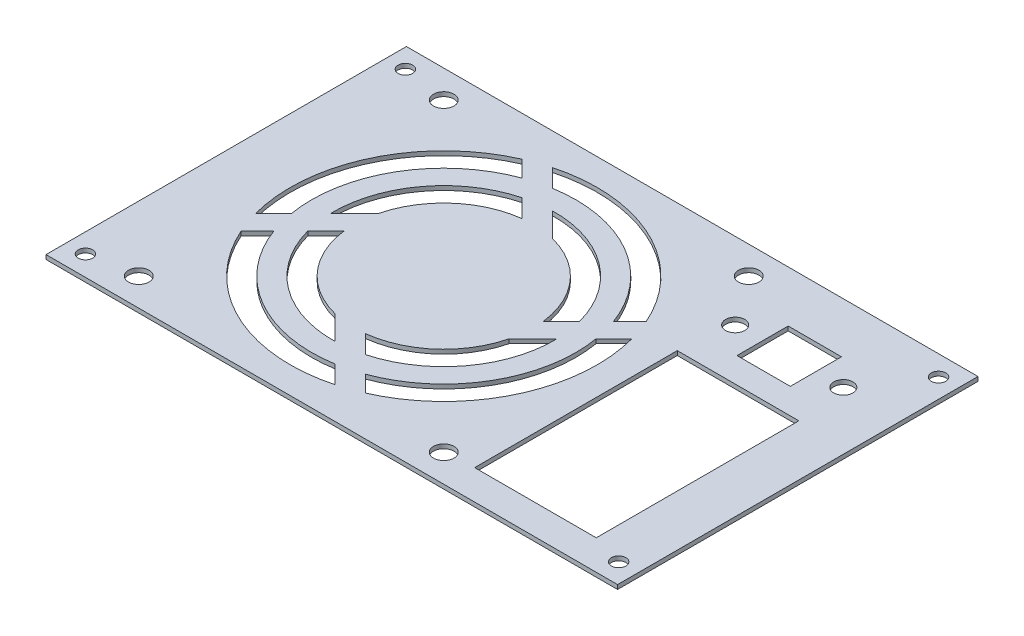
from build123d import *

# Parameters (mm, degrees)
SKETCH1_W                = 134
SKETCH1_H                = 84.5
BOSS_EXTRUDE1_DEPTH      = 1
M3_CLEARANCE_HOLE1_D     = 3.4
M3_CLEARANCE_HOLE1_DEPTH = 5
M3_CLEARANCE_HOLE1_TIP   = 1.021463052
M4_CLEARANCE_HOLE1_D     = 4.8
SKETCH9_W                = 28.5
SKETCH9_H                = 47.5
SKETCH9_W_2              = 12.5
SKETCH9_H_2              = 12
CUT_EXTRUDE1_DEPTH       = 159.421116017
M4_CLEARANCE_HOLE2_D     = 4.5
CUT_EXTRUDE5_DEPTH       = 159.421116017


with BuildPart() as part:
    # Sketch1 → Boss-Extrude1 (new body)
    with BuildSketch(Plane(origin=(0, 0, 0), x_dir=(1, 0, 0), z_dir=(0, 1, 0))):
        with Locations((67, 42.25)):
            Rectangle(SKETCH1_W, SKETCH1_H)
    extrude(amount=BOSS_EXTRUDE1_DEPTH)

    # M3 Clearance Hole1
    with Locations(Plane(origin=(0, 1, 0), x_dir=(1, 0, 0), z_dir=(0, 1, 0))):
        with Locations((4.5, 79.75), (129.5, 79.75), (129.5, 4.75), (4.5, 4.75)):
            Hole(M3_CLEARANCE_HOLE1_D / 2, depth=M3_CLEARANCE_HOLE1_DEPTH)
            with Locations((0, 0, -(M3_CLEARANCE_HOLE1_DEPTH + M3_CLEARANCE_HOLE1_TIP / 2))):  # 118° drill point
                Cone(0, M3_CLEARANCE_HOLE1_D / 2, M3_CLEARANCE_HOLE1_TIP, mode=Mode.SUBTRACT)

    # M4 Clearance Hole1 (through all)
    with Locations(Plane(origin=(0, 1, 0), x_dir=(1, 0, 0), z_dir=(0, 1, 0))):
        with Locations((15.25, 78), (86.75, 78), (86.75, 6.5), (15.25, 6.5)):
            Hole(M4_CLEARANCE_HOLE1_D / 2)

    # Sketch9 → Cut-Extrude1 (cut, through all)
    with BuildSketch(Plane(origin=(0, 1, 0), x_dir=(1, 0, 0), z_dir=(0, 1, 0))):
        with Locations((107.75, 30.75)):
            Rectangle(SKETCH9_W, SKETCH9_H)
        with Locations((107.75, 66.5)):
            Rectangle(SKETCH9_W_2, SKETCH9_H_2)
    extrude(amount=-CUT_EXTRUDE1_DEPTH, mode=Mode.SUBTRACT)

    # M4 Clearance Hole2 (through all)
    with Locations(Plane(origin=(0, 1, 0), x_dir=(1, 0, 0), z_dir=(0, 1, 0))):
        with Locations((95.075, 66.5), (120.425, 66.5)):
            Hole(M4_CLEARANCE_HOLE2_D / 2)

    # Sketch14 → Cut-Extrude5 (cut, through all)
    with BuildSketch(Plane(origin=(0, 1, 0), x_dir=(1, 0, 0), z_dir=(0, 1, 0))):
        with BuildLine():
            Line((71.854291945, 44.719515634), (76.114071484, 48.979295173))
            ThreePointArc((76.114071484, 48.979295173), (66.613295664, 63.040021609), (50.4614229, 68.244421223))
            Line((50.4614229, 68.244421223), (56.079392791, 62.626451332))
            ThreePointArc((56.079392791, 62.626451332), (66.757651713, 56.131513336), (71.854291945, 44.719515634))
        make_face()
        with BuildLine():
            Line((41.682514376, 77.023329746), (45.881353764, 72.824490359))
            ThreePointArc((45.881353764, 72.824490359), (66.567844262, 69.057503148), (80.092136898, 52.957360587))
            Line((80.092136898, 52.957360587), (83.930543096, 56.795766786))
            ThreePointArc((83.930543096, 56.795766786), (66.546147325, 74.720252592), (41.682514376, 77.023329746))
        make_face()
        with BuildLine():
            Line((53.469515634, 21.395708055), (57.729295173, 17.135928516))
            ThreePointArc((57.729295173, 17.135928516), (71.790021609, 26.636704336), (76.994421223, 42.7885771))
            Line((76.994421223, 42.7885771), (71.376451332, 37.170607209))
            ThreePointArc((71.376451332, 37.170607209), (64.881513336, 26.492348287), (53.469515634, 21.395708055))
        make_face()
        with BuildLine():
            Line((85.773329746, 51.567485624), (81.574490359, 47.368646236))
            ThreePointArc((81.574490359, 47.368646236), (77.807503148, 26.682155738), (61.707360587, 13.157863102))
            Line((61.707360587, 13.157863102), (65.545766786, 9.319456904))
            ThreePointArc((65.545766786, 9.319456904), (83.470252592, 26.703852675), (85.773329746, 51.567485624))
        make_face()
        with BuildLine():
            Line((30.145708055, 39.780484366), (25.885928516, 35.520704827))
            ThreePointArc((25.885928516, 35.520704827), (35.386704336, 21.459978391), (51.5385771, 16.255578777))
            Line((51.5385771, 16.255578777), (45.920607209, 21.873548668))
            ThreePointArc((45.920607209, 21.873548668), (35.242348287, 28.368486664), (30.145708055, 39.780484366))
        make_face()
        with BuildLine():
            Line((60.317485624, 7.476670254), (56.118646236, 11.675509641))
            ThreePointArc((56.118646236, 11.675509641), (35.432155738, 15.442496852), (21.907863102, 31.542639413))
            Line((21.907863102, 31.542639413), (18.069456904, 27.704233214))
            ThreePointArc((18.069456904, 27.704233214), (35.453852675, 9.779747408), (60.317485624, 7.476670254))
        make_face()
        with BuildLine():
            Line((48.530484366, 63.104291945), (44.270704827, 67.364071484))
            ThreePointArc((44.270704827, 67.364071484), (30.209978391, 57.863295664), (25.005578777, 41.7114229))
            Line((25.005578777, 41.7114229), (30.623548668, 47.329392791))
            ThreePointArc((30.623548668, 47.329392791), (37.118486664, 58.007651713), (48.530484366, 63.104291945))
        make_face()
        with BuildLine():
            Line((16.226670254, 32.932514376), (20.425509641, 37.131353764))
            ThreePointArc((20.425509641, 37.131353764), (24.192496852, 57.817844262), (40.292639413, 71.342136898))
            Line((40.292639413, 71.342136898), (36.454233214, 75.180543096))
            ThreePointArc((36.454233214, 75.180543096), (18.529747408, 57.796147325), (16.226670254, 32.932514376))
        make_face()
    extrude(amount=-CUT_EXTRUDE5_DEPTH, mode=Mode.SUBTRACT)


solid = part.part
